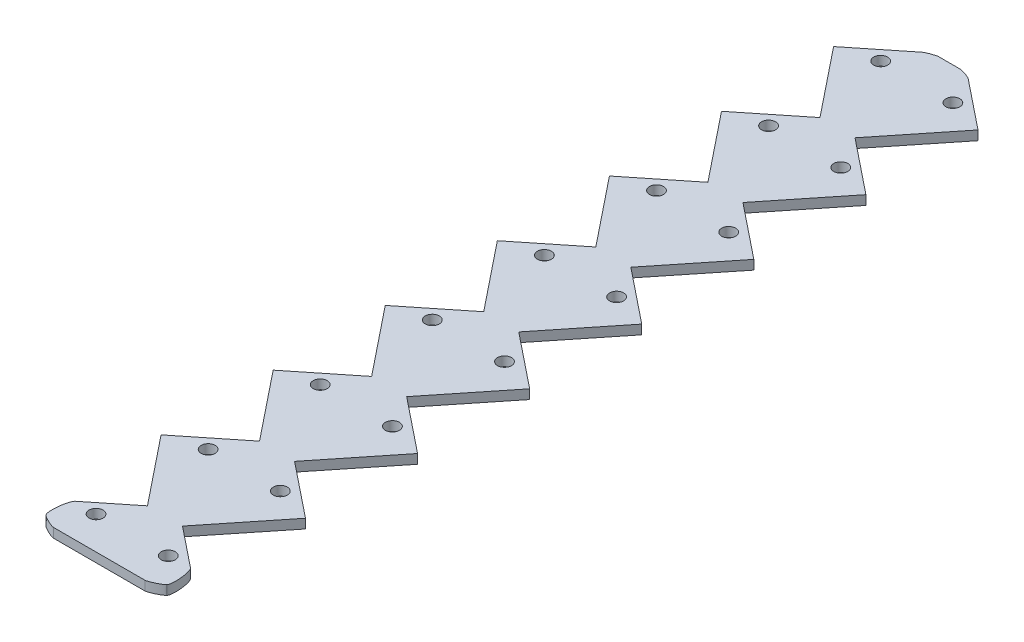
from build123d import *

# Parameters (mm, degrees)
SKETCH2_R           = 1.190625
BOSS_EXTRUDE1_DEPTH = 1.5875
FILLET1_SIZE        = 3.175


with BuildPart() as part:
    # Sketch2 → Boss-Extrude1 (new body)
    with BuildSketch(Plane(origin=(0, 0, 0), x_dir=(1, 0, 0), z_dir=(0, 1, 0))):
        Polygon((-9.038686402, -10.786161972), (0.255627025, -22.394755722), (-9.038686402, -29.836161972), (0.255627025, -41.444755722), (-9.038686402, -48.886161972), (0.255627025, -60.494755722), (-9.038686402, -67.936161972), (0.255627025, -79.544755722), (-9.038686402, -86.986161972), (0.255627025, -98.594755722), (-9.038686402, -106.036161972), (0.255627025, -117.644755722), (-9.038686402, -125.086161972), (-6.062123902, -128.803887343), (12.526502953, -128.803887343), (15.503065453, -125.086161972), (6.208752025, -117.644755722), (15.503065453, -106.036161972), (6.208752025, -98.594755722), (15.503065453, -86.986161972), (6.208752025, -79.544755722), (15.503065453, -67.936161972), (6.208752025, -60.494755722), (15.503065453, -48.886161972), (6.208752025, -41.444755722), (15.503065453, -29.836161972), (6.208752025, -22.394755722), (15.503065453, -10.786161972), (6.208752025, -3.344755722), (15.503065453, 8.263838028), (6.208752025, 15.705244278), (0.255627025, 15.705244278), (-9.038686402, 8.263838028), (0.255627025, -3.344755722), align=None)
        with Locations(Location((-2.903248438, 10.125678468, 0), (0, 0, 270))):
            Circle(SKETCH2_R, mode=Mode.SUBTRACT)
        with Locations(Location((-2.903248438, -8.924321532, 0), (0, 0, 270))):
            Circle(SKETCH2_R, mode=Mode.SUBTRACT)
        with Locations(Location((-2.903248438, -27.974321532, 0), (0, 0, 270))):
            Circle(SKETCH2_R, mode=Mode.SUBTRACT)
        with Locations(Location((-2.903248438, -47.024321532, 0), (0, 0, 270))):
            Circle(SKETCH2_R, mode=Mode.SUBTRACT)
        with Locations(Location((-2.903248438, -66.074321532, 0), (0, 0, 270))):
            Circle(SKETCH2_R, mode=Mode.SUBTRACT)
        with Locations(Location((-2.903248438, -85.124321532, 0), (0, 0, 270))):
            Circle(SKETCH2_R, mode=Mode.SUBTRACT)
        with Locations(Location((-2.903248438, -104.174321532, 0), (0, 0, 270))):
            Circle(SKETCH2_R, mode=Mode.SUBTRACT)
        with Locations(Location((-2.903248438, -123.224321532, 0), (0, 0, 270))):
            Circle(SKETCH2_R, mode=Mode.SUBTRACT)
        with Locations(Location((9.367627489, -123.224321532, 0), (0, 0, 270))):
            Circle(SKETCH2_R, mode=Mode.SUBTRACT)
        with Locations(Location((9.367627489, -104.174321532, 0), (0, 0, 270))):
            Circle(SKETCH2_R, mode=Mode.SUBTRACT)
        with Locations(Location((9.367627489, -85.124321532, 0), (0, 0, 270))):
            Circle(SKETCH2_R, mode=Mode.SUBTRACT)
        with Locations(Location((9.367627489, -66.074321532, 0), (0, 0, 270))):
            Circle(SKETCH2_R, mode=Mode.SUBTRACT)
        with Locations(Location((9.367627489, -47.024321532, 0), (0, 0, 270))):
            Circle(SKETCH2_R, mode=Mode.SUBTRACT)
        with Locations(Location((9.367627489, -27.974321532, 0), (0, 0, 270))):
            Circle(SKETCH2_R, mode=Mode.SUBTRACT)
        with Locations(Location((9.367627489, -8.924321532, 0), (0, 0, 270))):
            Circle(SKETCH2_R, mode=Mode.SUBTRACT)
        with Locations(Location((9.367627489, 10.125678468, 0), (0, 0, 270))):
            Circle(SKETCH2_R, mode=Mode.SUBTRACT)
    extrude(amount=BOSS_EXTRUDE1_DEPTH)

    # Fillet1
    # a fillet whose section is not a circle: 3.175 mm, written as the material it takes off along each edge
    with BuildSketch(Plane(origin=(6.208752025, -2.786065678, -15.705244278), x_dir=(0.7806247497998005, 0, 0.6249999999999992), z_dir=(0, 1, 0)), Plane(origin=(0.255627025, -2.786065678, -15.705244278), x_dir=(1, 0, 0), z_dir=(0, 1, 0))) as fillet1_piece_1:
        with BuildLine():
            Bezier((1.114426271, 0), (0, 0), (-0.869948729, -0.696516419), weights=[1, 0.299581461, 1])
            Line((-0.869948729, -0.696516419), (0, 0))
            Line((0, 0), (1.114426271, 0))
        make_face()
    extrude(amount=7.159631355, mode=Mode.SUBTRACT)
    with BuildSketch(Plane(origin=(-9.038686402, -7.9375, 125.086161972), x_dir=(0.7806247497997997, 0, -0.625), z_dir=(0, 1, 0)), Plane(origin=(15.503065453, -7.9375, 125.086161972), x_dir=(-0.6250000000125396, 0, 0.78062474978976), z_dir=(0, 1, 0))) as fillet1_piece_2:
        with BuildLine():
            Bezier((FILLET1_SIZE, 0), (0, 0), (0, -FILLET1_SIZE), weights=[1, 0.224506403, 1])
            Line((0, -FILLET1_SIZE), (0, 0))
            Line((0, 0), (FILLET1_SIZE, 0))
        make_face()
    extrude(amount=17.4625, mode=Mode.SUBTRACT)
    with BuildSketch(Plane(origin=(12.526502953, -3.813051662, 128.803887343), x_dir=(-1, 0, 0), z_dir=(0, 1, 0)), Plane(origin=(-6.062123902, -3.813051662, 128.803887343), x_dir=(-0.6249999999999978, 0, -0.7806247497998016), z_dir=(0, 1, 0))) as fillet1_piece_3:
        with BuildLine():
            Bezier((1.525220665, 0), (0, 0), (-0.953262916, -1.190625), weights=[1, 0.286190632, 1])
            Line((-0.953262916, -1.190625), (0, 0))
            Line((0, 0), (1.525220665, 0))
        make_face()
    extrude(amount=9.213603325, mode=Mode.SUBTRACT)


solid = part.part
